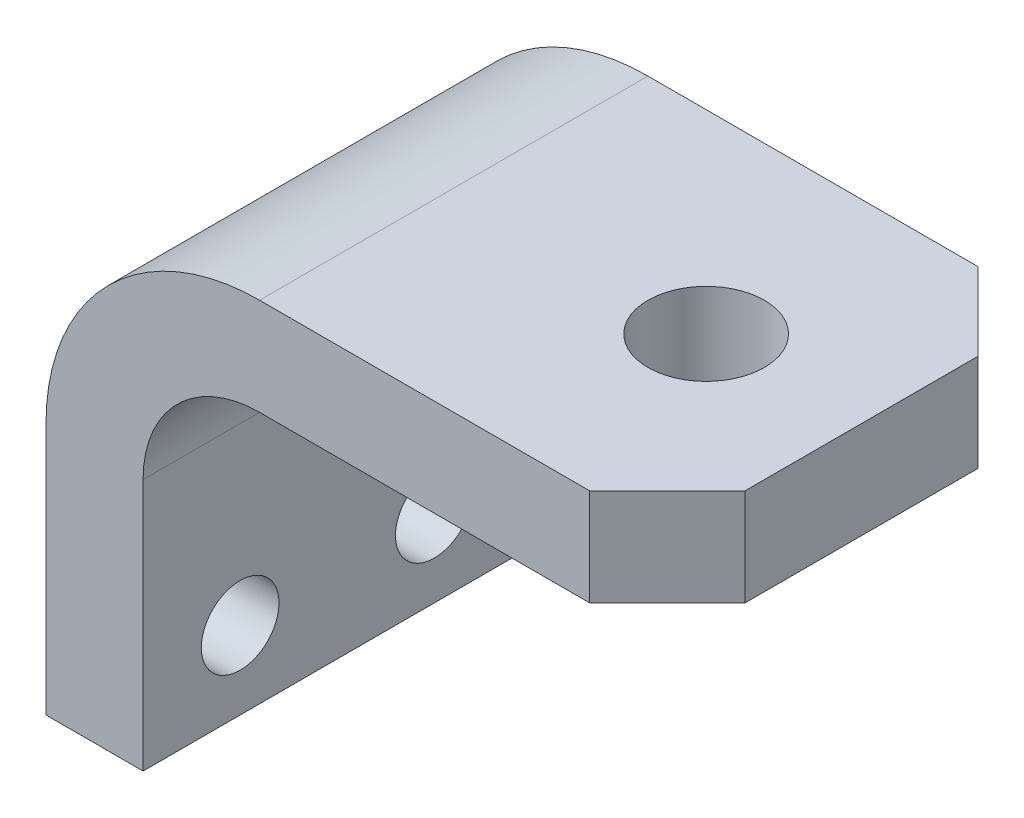
from build123d import *

# Parameters (mm, degrees)
BOSS_EXTRUDE1_DEPTH    = 31.75
SKETCH2_R              = 9.525
BALL_ANCHOR_HOLE_DEPTH = 113.342968182
F_45_DEG_CORNERS_DEPTH = 113.342968182
BOLT_HOLE_X_2_REACH    = 111.526
SKETCH4_R              = 6.35


with BuildPart() as part:
    # Sketch1 → Boss-Extrude1 (new, symmetric)
    with BuildSketch(Plane.XY):
        with BuildLine():
            Line((-76.2, -60.325), (-76.2, -19.05))
            ThreePointArc((-76.2, -19.05), (-65.970704333, 5.645704333), (-41.275, 15.875))
            Line((-41.275, 15.875), (25.4, 15.875))
            Line((25.4, 15.875), (25.4, 0))
            Line((25.4, 0), (-41.275, 0))
            ThreePointArc((-41.275, 0), (-54.745384182, -5.579615818), (-60.325, -19.05))
            Line((-60.325, -19.05), (-60.325, -60.325))
            Line((-60.325, -60.325), (-76.2, -60.325))
        make_face()
    extrude(amount=BOSS_EXTRUDE1_DEPTH, both=True)

    # Sketch2 → Ball Anchor hole (cut, through all)
    with BuildSketch(Plane(origin=(0, 15.875, 0), x_dir=(1, 0, 0), z_dir=(0, 1, 0))):
        Circle(SKETCH2_R)
    extrude(amount=-BALL_ANCHOR_HOLE_DEPTH, mode=Mode.SUBTRACT)

    # Sketch3 → 45 Deg Corners (cut, through all)
    with BuildSketch(Plane(origin=(0, 15.875, 0), x_dir=(1, 0, 0), z_dir=(0, 1, 0))):
        Polygon((12.7, 31.75), (25.4, 19.05), (25.4, 31.75), align=None)
        Polygon((12.7, -31.75), (25.4, -19.05), (25.4, -31.75), align=None)
    extrude(amount=-F_45_DEG_CORNERS_DEPTH, mode=Mode.SUBTRACT)

    # Sketch4 → Bolt Hole x 2 (cut, up to next)
    with BuildSketch(Plane(origin=(-60.325, 0, 0), x_dir=(0, 0, -1), z_dir=(1, 0, 0)), mode=Mode.PRIVATE) as bolt_hole_x_2_sk1:
        with Locations((-15.875, -47.625)):
            Circle(SKETCH4_R)
    bolt_hole_x_2_tool1 = extrude(bolt_hole_x_2_sk1.sketch, amount=-BOLT_HOLE_X_2_REACH, mode=Mode.PRIVATE) & part.part
    # Sketch4 → Bolt Hole x 2 (cut, up to next)
    with BuildSketch(Plane(origin=(-60.325, 0, 0), x_dir=(0, 0, -1), z_dir=(1, 0, 0)), mode=Mode.PRIVATE) as bolt_hole_x_2_sk2:
        with Locations((15.875, -47.625)):
            Circle(SKETCH4_R)
    bolt_hole_x_2_tool2 = extrude(bolt_hole_x_2_sk2.sketch, amount=-BOLT_HOLE_X_2_REACH, mode=Mode.PRIVATE) & part.part
    add(bolt_hole_x_2_tool1.solids().sort_by_distance((-60.325, -47.625, 15.875))[0], mode=Mode.SUBTRACT)
    add(bolt_hole_x_2_tool2.solids().sort_by_distance((-60.325, -47.625, -15.875))[0], mode=Mode.SUBTRACT)


solid = part.part
